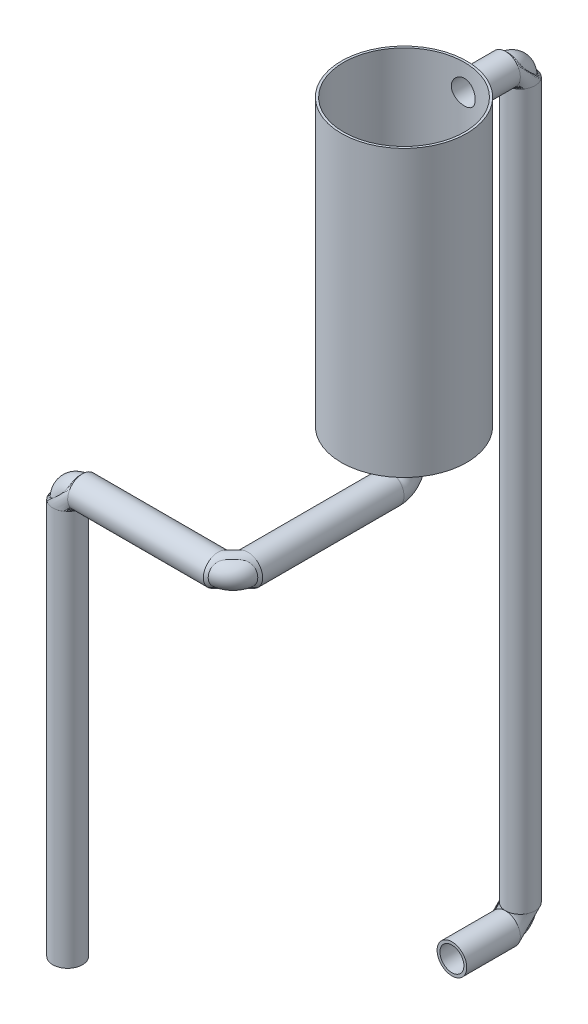
from build123d import *

# Parameters (mm, degrees)
SKETCH1_R               = 55
BOSS_EXTRUDE1_DEPTH     = 250
SHELL1_T                = -2
SKETCH6_R               = 13
CUT_EXTRUDE2_DEPTH      = 43
SKETCH18_R              = 13
SKETCH18_R_2            = 11
CUT_EXTRUDE3_DEPTH      = 40
CUT_EXTRUDE3_DEPTH_BACK = 30
SKETCH19_R              = 13
SKETCH20_R              = 13
SKETCH20_R_2            = 10.5
SKETCH21_R              = 13
SKETCH21_R_2            = 10.5
BOSS_EXTRUDE2_DEPTH     = 21
CUT_EXTRUDE4_START      = -50
CUT_EXTRUDE4_DEPTH      = 50


with BuildPart() as part:
    # Sketch1 → Boss-Extrude1 (new body)
    with BuildSketch(Plane(origin=(0, 0, 0), x_dir=(1, 0, 0), z_dir=(0, 1, 0))):
        Circle(SKETCH1_R)
    extrude(amount=BOSS_EXTRUDE1_DEPTH)

    # Shell1
    shell1_openings = [part.faces().sort_by_distance(p)[0] for p in [
        (0, 250, 0),
    ]]
    offset(amount=SHELL1_T, openings=shell1_openings, kind=Kind.INTERSECTION)

    # Sketch6 → Cut-Extrude2 (cut)
    with BuildSketch(Plane.XZ):
        Circle(SKETCH6_R)
    extrude(amount=-CUT_EXTRUDE2_DEPTH, mode=Mode.SUBTRACT)

    # Sketch19 → Cut-Extrude3 (cut, two sides: drawn at the far end of the back side and taken through both)
    with BuildSketch(Plane.XY.offset(-72).offset(-CUT_EXTRUDE3_DEPTH_BACK)):
        with Locations((0, 227.319310196)):
            Circle(SKETCH19_R)
    extrude(amount=CUT_EXTRUDE3_DEPTH + CUT_EXTRUDE3_DEPTH_BACK, mode=Mode.SUBTRACT)



with BuildPart() as body_2:
    # Sweep6: sweep along a curve in space
    with BuildLine() as sweep6_path:
        Line((0, 0, 0), (0, -27, 0))
        ThreePointArc((0, -27, 0), (0, -36.192388155, 3.807611845), (0, -40, 13))
        Line((0, -40, 13), (0, -40, 137))
        ThreePointArc((0, -40, 137), (-3.807611845, -40, 146.192388155), (-13, -40, 150))
        Line((-13, -40, 150), (-132, -40, 150))
        ThreePointArc((-132, -40, 150), (-141.192388155, -43.807611845, 150), (-145, -53, 150))
        Line((-145, -53, 150), (-145, -400, 150))
    # Sketch18 → Sweep6 (sweep)
    with BuildSketch(Plane.XZ):
        Circle(SKETCH18_R)
        Circle(SKETCH18_R_2, mode=Mode.SUBTRACT)
    sweep(path=sweep6_path.line)


with BuildPart() as body_3:
    # Sweep7: sweep along a curve in space
    with BuildLine() as sweep7_path:
        Line((0, 227.319310196, -72), (0, 227.319310196, -89))
        ThreePointArc((0, 227.319310196, -89), (0, 223.511698351, -98.192388155), (0, 214.319310196, -102))
        Line((0, 214.319310196, -102), (0, -412.470689804, -102))
        ThreePointArc((0, -412.470689804, -102), (0, -421.66307796, -98.192388155), (0, -425.470689804, -89))
        Line((0, -425.470689804, -89), (0, -425.470689804, -42))
    # Sketch20 → Sweep7 (sweep)
    with BuildSketch(Plane.XY.offset(-72)):
        with Locations((0, 227.319310196)):
            Circle(SKETCH20_R)
        with Locations((0, 227.319310196)):
            Circle(SKETCH20_R_2, mode=Mode.SUBTRACT)
    sweep(path=sweep7_path.line)


with BuildPart() as part_1:
    add(part.part)

    add(body_3.part)  # Boss-Extrude2 merges body 3
    # Sketch21 → Boss-Extrude2 (add)
    with BuildSketch(Plane.XY.offset(-72)):
        with Locations((0, 227.319310196)):
            Circle(SKETCH21_R)
        with Locations((0, 227.319310196)):
            Circle(SKETCH21_R_2, mode=Mode.SUBTRACT)
    extrude(amount=BOSS_EXTRUDE2_DEPTH)

    # Sketch22 → Cut-Extrude4 (cut)
    with BuildSketch(Plane(origin=(0, 250, 0), x_dir=(1, 0, 0), z_dir=(0, 1, 0)).offset(CUT_EXTRUDE4_START)):
        with BuildLine():
            Line((-13, 51), (13, 51))
            Line((13, 51), (13, 51.380930315))
            ThreePointArc((13, 51.380930315), (0, 53), (-13, 51.380930315))
            Line((-13, 51.380930315), (-13, 51))
        make_face()
    extrude(amount=CUT_EXTRUDE4_DEPTH, mode=Mode.SUBTRACT)


solid = Compound([body_2.part, part_1.part])
